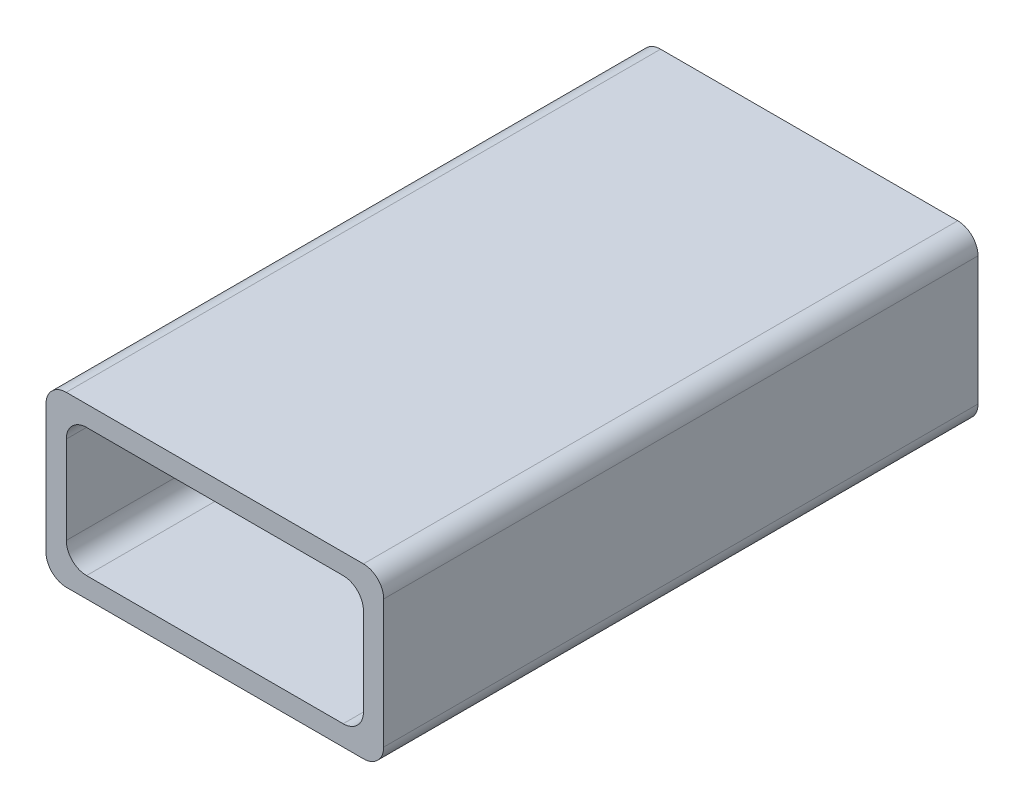
from build123d import *

# Parameters (mm, degrees)
SKETCH1_W           = 50.8
SKETCH1_H           = 25.4
SKETCH1_W_2         = 44.704
SKETCH1_H_2         = 19.304
BOSS_EXTRUDE1_DEPTH = 89.408
VARFILLET1_R        = 3.048


with BuildPart() as part:
    # Sketch1 → Boss-Extrude1 (new body)
    with BuildSketch(Plane.XY):
        with Locations((22.352, 9.652)):
            Rectangle(SKETCH1_W, SKETCH1_H)
        with Locations((22.352, 9.652)):
            Rectangle(SKETCH1_W_2, SKETCH1_H_2, mode=Mode.SUBTRACT)
    extrude(amount=BOSS_EXTRUDE1_DEPTH)

    # VarFillet1
    varfillet1_edges = [part.edges().sort_by_distance(p)[0] for p in [
        (0, 19.304, 44.704),
        (0, 0, 44.704),
        (44.704, 19.304, 44.704),
        (44.704, 0, 44.704),
        (47.752, -3.048, 44.704),
        (47.752, 22.352, 44.704),
        (-3.048, 22.352, 44.704),
        (-3.048, -3.048, 44.704),
    ]]
    fillet(varfillet1_edges, radius=VARFILLET1_R)


solid = part.part
